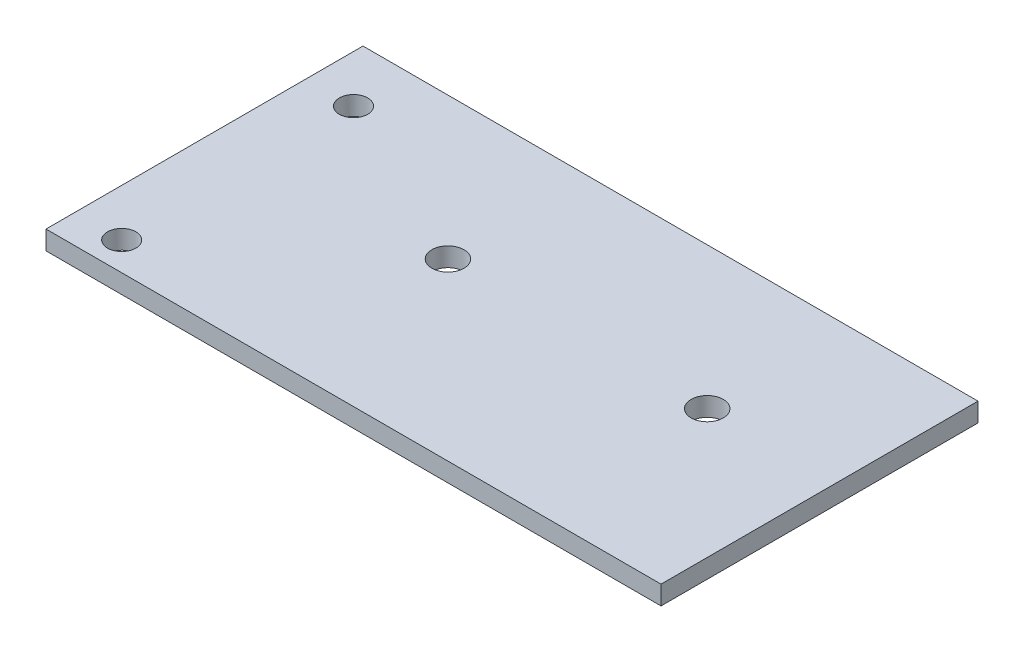
from build123d import *

# Parameters (mm, degrees)
SKETCH1_W                       = 65
SKETCH1_H                       = 33.5
BOSS_EXTRUDE1_DEPTH             = 2
M3_CLEARANCE_HOLE4_D            = 3.4
M3X0_5_TAPPED_HOLE1_D           = 2.5
M3X0_5_TAPPED_HOLE1_DEPTH       = 10
M3X0_5_TAPPED_HOLE1_CBORE_D     = 3
M3X0_5_TAPPED_HOLE1_CBORE_DEPTH = 6
M3X0_5_TAPPED_HOLE1_TIP         = 0.751075774


with BuildPart() as part:
    # Sketch1 → Boss-Extrude1 (new body)
    with BuildSketch(Plane(origin=(0, 0, 0), x_dir=(1, 0, 0), z_dir=(0, 1, 0))):
        with Locations((-52.366085356, 13.7444519)):
            Rectangle(SKETCH1_W, SKETCH1_H)
    extrude(amount=BOSS_EXTRUDE1_DEPTH)

    # M3 Clearance Hole4 (through all)
    with Locations(Plane(origin=(0, 0, 0), x_dir=(-1, 0, 0), z_dir=(0, -1, 0))):
        with Locations((33.486085356, 15.4944519), (60.886085356, 15.4944519)):
            Hole(M3_CLEARANCE_HOLE4_D / 2)

    # M3x0.5 Tapped Hole1
    with Locations(Plane(origin=(-79.866085356, 0, 0.0055481), x_dir=(0, 0, -1), z_dir=(0, -1, 0))):
        with Locations((0, 0), (24.5, 0)):
            CounterBoreHole(M3X0_5_TAPPED_HOLE1_D / 2, M3X0_5_TAPPED_HOLE1_CBORE_D / 2, M3X0_5_TAPPED_HOLE1_CBORE_DEPTH, depth=M3X0_5_TAPPED_HOLE1_DEPTH)
            with Locations((0, 0, -(M3X0_5_TAPPED_HOLE1_DEPTH + M3X0_5_TAPPED_HOLE1_TIP / 2))):  # 118° drill point
                Cone(0, M3X0_5_TAPPED_HOLE1_D / 2, M3X0_5_TAPPED_HOLE1_TIP, mode=Mode.SUBTRACT)


solid = part.part
